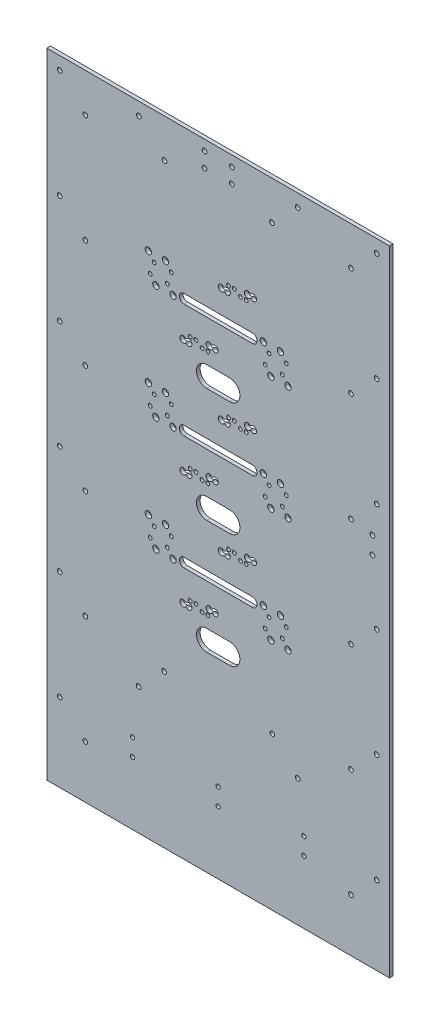
from build123d import *

# Parameters (mm, degrees)
SKETCH1_W           = 300
SKETCH1_H           = 555
BOSS_EXTRUDE1_DEPTH = 3.175
CUT_EXTRUDE1_DEPTH  = 10
SKETCH6_R           = 2.05
CUT_EXTRUDE5_DEPTH  = 51
SKETCH8_R           = 2.1
CUT_EXTRUDE7_DEPTH  = 67
SKETCH9_R           = 2.05
CUT_EXTRUDE8_DEPTH  = 10
SKETCH10_R          = 1.651
SKETCH10_R_2        = 2.794
CUT_EXTRUDE9_DEPTH  = 10
SKETCH12_R          = 1.85
CUT_EXTRUDE10_DEPTH = 10
CUT_EXTRUDE11_DEPTH = 29.1


with BuildPart() as part:
    # Sketch1 → Boss-Extrude1 (new body)
    with BuildSketch(Plane.XY):
        with Locations((-15.986837609, 112.215563673)):
            Rectangle(SKETCH1_W, SKETCH1_H)
    extrude(amount=BOSS_EXTRUDE1_DEPTH)

    # Sketch4 → Cut-Extrude1 (cut)
    with BuildSketch(Plane.XY.offset(3.175)):
        with BuildLine():
            Line((-45.986837609, 263.715563673), (14.013162391, 263.715563673))
            ThreePointArc((14.013162391, 263.715563673), (18.013162391, 259.715563673), (14.013162391, 255.715563673))
            Line((14.013162391, 255.715563673), (-45.986837609, 255.715563673))
            ThreePointArc((-45.986837609, 255.715563673), (-49.986837609, 259.715563673), (-45.986837609, 263.715563673))
        make_face()
        with BuildLine():
            Line((-45.986837609, 163.715563673), (14.013162391, 163.715563673))
            ThreePointArc((14.013162391, 163.715563673), (18.013162391, 159.715563673), (14.013162391, 155.715563673))
            Line((14.013162391, 155.715563673), (-45.986837609, 155.715563673))
            ThreePointArc((-45.986837609, 155.715563673), (-49.986837609, 159.715563673), (-45.986837609, 163.715563673))
        make_face()
        with BuildLine():
            Line((-45.986837609, 63.715563673), (14.013162391, 63.715563673))
            ThreePointArc((14.013162391, 63.715563673), (18.013162391, 59.715563673), (14.013162391, 55.715563673))
            Line((14.013162391, 55.715563673), (-45.986837609, 55.715563673))
            ThreePointArc((-45.986837609, 55.715563673), (-49.986837609, 59.715563673), (-45.986837609, 63.715563673))
        make_face()
    extrude(amount=-CUT_EXTRUDE1_DEPTH, mode=Mode.SUBTRACT)

    # Sketch6 → Cut-Extrude5 (cut)
    with BuildSketch(Plane(origin=(0, 0, 0), x_dir=(-1, 0, 0), z_dir=(0, 0, -1))):
        with Locations((3.986837609, 380.715563673)):
            Circle(SKETCH6_R)
        with Locations((27.986837609, 380.715563673)):
            Circle(SKETCH6_R)
        with Locations((27.986837609, 367.715563673)):
            Circle(SKETCH6_R)
        with Locations((3.986837609, 367.715563673)):
            Circle(SKETCH6_R)
    extrude(amount=-CUT_EXTRUDE5_DEPTH, mode=Mode.SUBTRACT)

    # Sketch8 → Cut-Extrude7 (cut)
    with BuildSketch(Plane(origin=(0, 0, 0), x_dir=(-1, 0, 0), z_dir=(0, 0, -1))):
        with Locations((-119.013162391, 162.980338842)):
            Circle(SKETCH8_R)
        with Locations((-119.013162391, 147.980338842)):
            Circle(SKETCH8_R)
    extrude(amount=-CUT_EXTRUDE7_DEPTH, mode=Mode.SUBTRACT)

    # Sketch9 → Cut-Extrude8 (cut)
    with BuildSketch(Plane(origin=(0, 0, 0), x_dir=(-1, 0, 0), z_dir=(0, 0, -1))):
        with Locations((-122.763162391, 378.465563673)):
            Circle(SKETCH9_R)
        with Locations((-100.263162391, 355.965563673)):
            Circle(SKETCH9_R)
        with Locations((-53.536763897, 378.465563673)):
            Circle(SKETCH9_R)
        with Locations((-31.036763897, 355.965563673)):
            Circle(SKETCH9_R)
        with Locations((-122.763162391, 283.465563673)):
            Circle(SKETCH9_R)
        with Locations((-100.263162391, 260.965563673)):
            Circle(SKETCH9_R)
        with Locations((-122.763162391, 188.465563673)):
            Circle(SKETCH9_R)
        with Locations((-100.263162391, 165.965563673)):
            Circle(SKETCH9_R)
        with Locations((-122.763162391, 93.465563673)):
            Circle(SKETCH9_R)
        with Locations((-100.263162391, 70.965563673)):
            Circle(SKETCH9_R)
        with Locations((-122.763162391, -1.534436327)):
            Circle(SKETCH9_R)
        with Locations((-100.263162391, -24.034436327)):
            Circle(SKETCH9_R)
        with Locations((-122.763162391, -96.534436327)):
            Circle(SKETCH9_R)
        with Locations((-100.263162391, -119.034436327)):
            Circle(SKETCH9_R)
        with Locations((-122.763162391, -191.534436327)):
            Circle(SKETCH9_R)
        with Locations((-100.263162391, -214.034436327)):
            Circle(SKETCH9_R)
        with Locations((-53.648179996, -54.034436327)):
            Circle(SKETCH9_R)
        with Locations((-31.371012194, -31.534436327)):
            Circle(SKETCH9_R)
        with Locations((63.344687413, -31.534436327)):
            Circle(SKETCH9_R)
        with Locations((85.621855215, -54.034436327)):
            Circle(SKETCH9_R)
        with Locations((132.236837609, -214.034436327)):
            Circle(SKETCH9_R)
        with Locations((154.736837609, -191.534436327)):
            Circle(SKETCH9_R)
        with Locations((132.236837609, -119.034436327)):
            Circle(SKETCH9_R)
        with Locations((154.736837609, -96.534436327)):
            Circle(SKETCH9_R)
        with Locations((132.236837609, -24.034436327)):
            Circle(SKETCH9_R)
        with Locations((154.736837609, -1.534436327)):
            Circle(SKETCH9_R)
        with Locations((132.236837609, 70.965563673)):
            Circle(SKETCH9_R)
        with Locations((154.736837609, 93.465563673)):
            Circle(SKETCH9_R)
        with Locations((132.236837609, 165.965563673)):
            Circle(SKETCH9_R)
        with Locations((154.736837609, 188.465563673)):
            Circle(SKETCH9_R)
        with Locations((132.236837609, 260.965563673)):
            Circle(SKETCH9_R)
        with Locations((154.736837609, 283.465563673)):
            Circle(SKETCH9_R)
        with Locations((63.010439116, 355.965563673)):
            Circle(SKETCH9_R)
        with Locations((85.510439116, 378.465563673)):
            Circle(SKETCH9_R)
        with Locations((132.236837609, 355.965563673)):
            Circle(SKETCH9_R)
        with Locations((154.736837609, 378.465563673)):
            Circle(SKETCH9_R)
    extrude(amount=-CUT_EXTRUDE8_DEPTH, mode=Mode.SUBTRACT)

    # Sketch10 → Cut-Extrude9 (cut)
    with BuildSketch(Plane(origin=(0, 0, 0), x_dir=(-1, 0, 0), z_dir=(0, 0, -1))):
        with Locations((35.464045315, 33.621645855)):
            Circle(SKETCH10_R)
        with Locations((25.105079811, 30.160155179)):
            Circle(SKETCH10_R)
        with Locations((-30.126255431, 38.933594969)):
            Circle(SKETCH10_R_2)
        with Locations((-23.543411665, 61.884184155)):
            Circle(SKETCH10_R_2)
        with Locations((-25.10242235, 45.229963762)):
            Circle(SKETCH10_R)
        with Locations((-28.567244746, 55.587815362)):
            Circle(SKETCH10_R)
        with Locations((-45.126255431, 38.933594969)):
            Circle(SKETCH10_R_2)
        with Locations((-38.543411665, 61.884184155)):
            Circle(SKETCH10_R_2)
        with Locations((-40.10242235, 45.229963762)):
            Circle(SKETCH10_R)
        with Locations((-43.567244746, 55.587815362)):
            Circle(SKETCH10_R)
        with Locations((40.464045315, 33.621645855)):
            Circle(SKETCH10_R)
        with Locations((30.105079811, 30.160155179)):
            Circle(SKETCH10_R)
        with Locations((55.517086884, 57.54692847)):
            Circle(SKETCH10_R_2)
        with Locations((70.517086884, 57.54692847)):
            Circle(SKETCH10_R_2)
        with Locations((75.540919965, 63.843297263)):
            Circle(SKETCH10_R)
        with Locations((60.540919965, 63.843297263)):
            Circle(SKETCH10_R)
        with Locations((-3.490370096, 85.80947413)):
            Circle(SKETCH10_R)
        with Locations((6.868595408, 89.270964805)):
            Circle(SKETCH10_R)
        with Locations((62.09993065, 80.497517656)):
            Circle(SKETCH10_R_2)
        with Locations((57.076097569, 74.201148863)):
            Circle(SKETCH10_R)
        with Locations((77.09993065, 80.497517656)):
            Circle(SKETCH10_R_2)
        with Locations((72.076097569, 74.201148863)):
            Circle(SKETCH10_R)
        with Locations((-8.490370096, 85.80947413)):
            Circle(SKETCH10_R)
        with Locations((1.868595408, 89.270964805)):
            Circle(SKETCH10_R)
        with Locations((35.464045315, 133.621645855)):
            Circle(SKETCH10_R)
        with Locations((25.105079811, 130.160155179)):
            Circle(SKETCH10_R)
        with Locations((-30.126255431, 138.933594969)):
            Circle(SKETCH10_R_2)
        with Locations((-23.543411665, 161.884184155)):
            Circle(SKETCH10_R_2)
        with Locations((-25.10242235, 145.229963762)):
            Circle(SKETCH10_R)
        with Locations((-28.567244746, 155.587815362)):
            Circle(SKETCH10_R)
        with Locations((-45.126255431, 138.933594969)):
            Circle(SKETCH10_R_2)
        with Locations((-38.543411665, 161.884184155)):
            Circle(SKETCH10_R_2)
        with Locations((-40.10242235, 145.229963762)):
            Circle(SKETCH10_R)
        with Locations((-43.567244746, 155.587815362)):
            Circle(SKETCH10_R)
        with Locations((40.464045315, 133.621645855)):
            Circle(SKETCH10_R)
        with Locations((30.105079811, 130.160155179)):
            Circle(SKETCH10_R)
        with Locations((55.517086884, 157.54692847)):
            Circle(SKETCH10_R_2)
        with Locations((70.517086884, 157.54692847)):
            Circle(SKETCH10_R_2)
        with Locations((75.540919965, 163.843297263)):
            Circle(SKETCH10_R)
        with Locations((60.540919965, 163.843297263)):
            Circle(SKETCH10_R)
        with Locations((-3.490370096, 185.80947413)):
            Circle(SKETCH10_R)
        with Locations((6.868595408, 189.270964805)):
            Circle(SKETCH10_R)
        with Locations((62.09993065, 180.497517656)):
            Circle(SKETCH10_R_2)
        with Locations((57.076097569, 174.201148863)):
            Circle(SKETCH10_R)
        with Locations((77.09993065, 180.497517656)):
            Circle(SKETCH10_R_2)
        with Locations((72.076097569, 174.201148863)):
            Circle(SKETCH10_R)
        with Locations((-8.490370096, 185.80947413)):
            Circle(SKETCH10_R)
        with Locations((1.868595408, 189.270964805)):
            Circle(SKETCH10_R)
        with Locations((35.464045315, 233.621645855)):
            Circle(SKETCH10_R)
        with Locations((25.105079811, 230.160155179)):
            Circle(SKETCH10_R)
        with Locations((-30.126255431, 238.933594969)):
            Circle(SKETCH10_R_2)
        with Locations((-23.543411665, 261.884184155)):
            Circle(SKETCH10_R_2)
        with Locations((-25.10242235, 245.229963762)):
            Circle(SKETCH10_R)
        with Locations((-28.567244746, 255.587815362)):
            Circle(SKETCH10_R)
        with Locations((-45.126255431, 238.933594969)):
            Circle(SKETCH10_R_2)
        with Locations((-38.543411665, 261.884184155)):
            Circle(SKETCH10_R_2)
        with Locations((-40.10242235, 245.229963762)):
            Circle(SKETCH10_R)
        with Locations((-43.567244746, 255.587815362)):
            Circle(SKETCH10_R)
        with Locations((40.464045315, 233.621645855)):
            Circle(SKETCH10_R)
        with Locations((30.105079811, 230.160155179)):
            Circle(SKETCH10_R)
        with Locations((55.517086884, 257.54692847)):
            Circle(SKETCH10_R_2)
        with Locations((70.517086884, 257.54692847)):
            Circle(SKETCH10_R_2)
        with Locations((75.540919965, 263.843297263)):
            Circle(SKETCH10_R)
        with Locations((60.540919965, 263.843297263)):
            Circle(SKETCH10_R)
        with Locations((-3.490370096, 285.80947413)):
            Circle(SKETCH10_R)
        with Locations((6.868595408, 289.270964805)):
            Circle(SKETCH10_R)
        with Locations((62.09993065, 280.497517656)):
            Circle(SKETCH10_R_2)
        with Locations((57.076097569, 274.201148863)):
            Circle(SKETCH10_R)
        with Locations((77.09993065, 280.497517656)):
            Circle(SKETCH10_R_2)
        with Locations((72.076097569, 274.201148863)):
            Circle(SKETCH10_R)
        with Locations((-8.490370096, 285.80947413)):
            Circle(SKETCH10_R)
        with Locations((1.868595408, 289.270964805)):
            Circle(SKETCH10_R)
        with BuildLine():
            ThreePointArc((43.599862735, 30.697433927), (38.964797896, 28.595787844), (43.599862735, 26.494141761))
            ThreePointArc((43.599862735, 26.494141761), (44.258797896, 26.741942018), (44.917733056, 26.494141761))
            ThreePointArc((44.917733056, 26.494141761), (49.552797895, 28.595787844), (44.917733056, 30.697433927))
            ThreePointArc((44.917733056, 30.697433927), (44.258797896, 30.44963367), (43.599862735, 30.697433927))
        make_face()
        with BuildLine():
            ThreePointArc((20.651392069, 37.287659273), (16.01632723, 35.18601319), (20.651392069, 33.084367108))
            ThreePointArc((20.651392069, 33.084367108), (21.31032723, 33.332167364), (21.969262391, 33.084367108))
            ThreePointArc((21.969262391, 33.084367108), (26.60432723, 35.18601319), (21.969262391, 37.287659273))
            ThreePointArc((21.969262391, 37.287659273), (21.31032723, 37.039859016), (20.651392069, 37.287659273))
        make_face()
        with BuildLine():
            ThreePointArc((-11.626187516, 88.733686058), (-6.991122677, 90.835332141), (-11.626187516, 92.936978224))
            ThreePointArc((-11.626187516, 92.936978224), (-12.285122677, 92.689177967), (-12.944057838, 92.936978224))
            ThreePointArc((-12.944057838, 92.936978224), (-17.579122676, 90.835332141), (-12.944057838, 88.733686058))
            ThreePointArc((-12.944057838, 88.733686058), (-12.285122677, 88.981486315), (-11.626187516, 88.733686058))
        make_face()
        with BuildLine():
            ThreePointArc((11.32228315, 82.143460711), (15.957347989, 84.245106794), (11.32228315, 86.346752877))
            ThreePointArc((11.32228315, 86.346752877), (10.663347989, 86.09895262), (10.004412828, 86.346752877))
            ThreePointArc((10.004412828, 86.346752877), (5.369347989, 84.245106794), (10.004412828, 82.143460711))
            ThreePointArc((10.004412828, 82.143460711), (10.663347989, 82.391260968), (11.32228315, 82.143460711))
        make_face()
        with BuildLine():
            ThreePointArc((43.599862735, 130.697433927), (38.964797896, 128.595787844), (43.599862735, 126.494141761))
            ThreePointArc((43.599862735, 126.494141761), (44.258797896, 126.741942018), (44.917733056, 126.494141761))
            ThreePointArc((44.917733056, 126.494141761), (49.552797895, 128.595787844), (44.917733056, 130.697433927))
            ThreePointArc((44.917733056, 130.697433927), (44.258797896, 130.44963367), (43.599862735, 130.697433927))
        make_face()
        with BuildLine():
            ThreePointArc((20.651392069, 137.287659273), (16.01632723, 135.18601319), (20.651392069, 133.084367108))
            ThreePointArc((20.651392069, 133.084367108), (21.31032723, 133.332167364), (21.969262391, 133.084367108))
            ThreePointArc((21.969262391, 133.084367108), (26.60432723, 135.18601319), (21.969262391, 137.287659273))
            ThreePointArc((21.969262391, 137.287659273), (21.31032723, 137.039859016), (20.651392069, 137.287659273))
        make_face()
        with BuildLine():
            ThreePointArc((-11.626187516, 188.733686058), (-6.991122677, 190.835332141), (-11.626187516, 192.936978224))
            ThreePointArc((-11.626187516, 192.936978224), (-12.285122677, 192.689177967), (-12.944057838, 192.936978224))
            ThreePointArc((-12.944057838, 192.936978224), (-17.579122676, 190.835332141), (-12.944057838, 188.733686058))
            ThreePointArc((-12.944057838, 188.733686058), (-12.285122677, 188.981486315), (-11.626187516, 188.733686058))
        make_face()
        with BuildLine():
            ThreePointArc((11.32228315, 182.143460711), (15.957347989, 184.245106794), (11.32228315, 186.346752877))
            ThreePointArc((11.32228315, 186.346752877), (10.663347989, 186.09895262), (10.004412828, 186.346752877))
            ThreePointArc((10.004412828, 186.346752877), (5.369347989, 184.245106794), (10.004412828, 182.143460711))
            ThreePointArc((10.004412828, 182.143460711), (10.663347989, 182.391260968), (11.32228315, 182.143460711))
        make_face()
        with BuildLine():
            ThreePointArc((43.599862735, 230.697433927), (38.964797896, 228.595787844), (43.599862735, 226.494141761))
            ThreePointArc((43.599862735, 226.494141761), (44.258797896, 226.741942018), (44.917733056, 226.494141761))
            ThreePointArc((44.917733056, 226.494141761), (49.552797895, 228.595787844), (44.917733056, 230.697433927))
            ThreePointArc((44.917733056, 230.697433927), (44.258797896, 230.44963367), (43.599862735, 230.697433927))
        make_face()
        with BuildLine():
            ThreePointArc((20.651392069, 237.287659273), (16.01632723, 235.18601319), (20.651392069, 233.084367108))
            ThreePointArc((20.651392069, 233.084367108), (21.31032723, 233.332167364), (21.969262391, 233.084367108))
            ThreePointArc((21.969262391, 233.084367108), (26.60432723, 235.18601319), (21.969262391, 237.287659273))
            ThreePointArc((21.969262391, 237.287659273), (21.31032723, 237.039859016), (20.651392069, 237.287659273))
        make_face()
        with BuildLine():
            ThreePointArc((-11.626187516, 288.733686058), (-6.991122677, 290.835332141), (-11.626187516, 292.936978224))
            ThreePointArc((-11.626187516, 292.936978224), (-12.285122677, 292.689177967), (-12.944057838, 292.936978224))
            ThreePointArc((-12.944057838, 292.936978224), (-17.579122677, 290.835332141), (-12.944057838, 288.733686058))
            ThreePointArc((-12.944057838, 288.733686058), (-12.285122677, 288.981486315), (-11.626187516, 288.733686058))
        make_face()
        with BuildLine():
            ThreePointArc((11.32228315, 282.143460711), (15.957347989, 284.245106794), (11.32228315, 286.346752877))
            ThreePointArc((11.32228315, 286.346752877), (10.663347989, 286.09895262), (10.004412828, 286.346752877))
            ThreePointArc((10.004412828, 286.346752877), (5.369347989, 284.245106794), (10.004412828, 282.143460711))
            ThreePointArc((10.004412828, 282.143460711), (10.663347989, 282.391260968), (11.32228315, 282.143460711))
        make_face()
    extrude(amount=-CUT_EXTRUDE9_DEPTH, mode=Mode.SUBTRACT)

    # Sketch12 → Cut-Extrude10 (cut)
    with BuildSketch(Plane(origin=(0, 0, 0), x_dir=(-1, 0, 0), z_dir=(0, 0, -1))):
        with Locations((90.986837609, -95.207773245)):
            Circle(SKETCH12_R)
        with Locations((90.986837609, -110.207773245)):
            Circle(SKETCH12_R)
        with Locations((15.986837609, -95.207773245)):
            Circle(SKETCH12_R)
        with Locations((15.986837609, -110.207773245)):
            Circle(SKETCH12_R)
        with Locations((-59.013162391, -95.207773245)):
            Circle(SKETCH12_R)
        with Locations((-59.013162391, -110.207773245)):
            Circle(SKETCH12_R)
    extrude(amount=-CUT_EXTRUDE10_DEPTH, mode=Mode.SUBTRACT)

    # Sketch13 → Cut-Extrude11 (cut)
    with BuildSketch(Plane.XY.offset(3.175)):
        with BuildLine():
            Line((-25.986837609, 19.715563673), (-5.986837609, 19.715563673))
            ThreePointArc((-5.986837609, 19.715563673), (3.013162391, 10.715563673), (-5.986837609, 1.715563673))
            Line((-5.986837609, 1.715563673), (-25.986837609, 1.715563673))
            ThreePointArc((-25.986837609, 1.715563673), (-34.986837609, 10.715563673), (-25.986837609, 19.715563673))
        make_face()
        with BuildLine():
            Line((-25.986837609, 119.715563673), (-5.986837609, 119.715563673))
            ThreePointArc((-5.986837609, 119.715563673), (3.013162391, 110.715563673), (-5.986837609, 101.715563673))
            Line((-5.986837609, 101.715563673), (-25.986837609, 101.715563673))
            ThreePointArc((-25.986837609, 101.715563673), (-34.986837609, 110.715563673), (-25.986837609, 119.715563673))
        make_face()
        with BuildLine():
            Line((-25.986837609, 219.715563673), (-5.986837609, 219.715563673))
            ThreePointArc((-5.986837609, 219.715563673), (3.013162391, 210.715563673), (-5.986837609, 201.715563673))
            Line((-5.986837609, 201.715563673), (-25.986837609, 201.715563673))
            ThreePointArc((-25.986837609, 201.715563673), (-34.986837609, 210.715563673), (-25.986837609, 219.715563673))
        make_face()
    extrude(amount=-CUT_EXTRUDE11_DEPTH, mode=Mode.SUBTRACT)


solid = part.part
